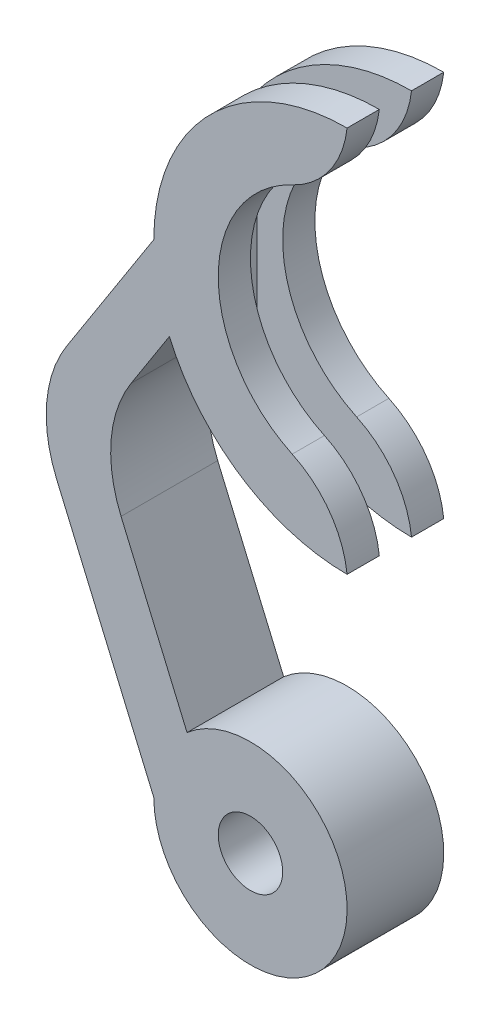
from build123d import *

# Parameters (mm, degrees)
BOSS_EXTRUDE1_DEPTH = 15
FILLET1_R           = 20
FILLET2_R           = 15
SKETCH2_W           = 5
SKETCH2_H           = 60
CUT_EXTRUDE1_DEPTH  = 24


with BuildPart() as part:
    # Sketch1 → Boss-Extrude1 (new body)
    # profile 1 of 6: a face of its own
    with BuildSketch(Plane.XY):
        with BuildLine():
            Line((-20, -30), (-30, -30))
            ThreePointArc((-30, -30), (-29.388396861, -36.026784376), (-27.578524672, -41.807835403))
            Line((-27.578524672, -41.807835403), (-20, -30))
        make_face()
    # profile 2 of 6: a face of its own
    with BuildSketch(Plane.XY):
        with BuildLine():
            Line((0, -10), (0, 0))
            ThreePointArc((0, 0), (-21.213203436, -8.786796564), (-30, -30))
            Line((-30, -30), (-20, -30))
            ThreePointArc((-20, -30), (-14.142135624, -15.857864376), (0, -10))
        make_face()
    # profile 3 of 6: a face of its own
    with BuildSketch(Plane.XY):
        with BuildLine():
            ThreePointArc((0, -50), (-14.142135624, -44.142135624), (-20, -30))
            Line((-20, -30), (-27.578524672, -41.807835403))
            ThreePointArc((-27.578524672, -41.807835403), (-16.519154608, -55.04231481), (0, -60))
            Line((0, -60), (0, -50))
        make_face()
    # profile 4 of 6: a face of its own
    with BuildSketch(Plane.XY):
        with BuildLine():
            ThreePointArc((-27.578524672, -41.807835403), (-29.388396861, -36.026784376), (-30, -30))
            Line((-30, -30), (-49.254650189, -60))
            Line((-49.254650189, -60), (-30, -105))
            ThreePointArc((-30, -105), (-28.650020621, -98.780921528), (-24.84307506, -93.681260081))
            Line((-24.84307506, -93.681260081), (-39.254650189, -60))
            Line((-39.254650189, -60), (-27.578524672, -41.807835403))
        make_face()
    # profile 5 of 6: a face of its own
    with BuildSketch(Plane.XY):
        with BuildLine():
            ThreePointArc((-24.84307506, -93.681260081), (-28.650020621, -98.780921528), (-30, -105))
            Line((-30, -105), (-20, -105))
            Line((-20, -105), (-24.84307506, -93.681260081))
        make_face()
    # profile 6 of 6: a face of its own
    with BuildSketch(Plane.XY):
        with BuildLine():
            Line((-20, -105), (-30, -105))
            ThreePointArc((-30, -105), (-15, -120), (0, -105))
            ThreePointArc((0, -105), (-8.780921528, -91.349979379), (-24.84307506, -93.681260081))
            Line((-24.84307506, -93.681260081), (-20, -105))
        make_face()
        with BuildLine():
            ThreePointArc((-10, -105), (-15, -110), (-20, -105))
            ThreePointArc((-20, -105), (-15, -100), (-10, -105))
        make_face(mode=Mode.SUBTRACT)
    extrude(amount=BOSS_EXTRUDE1_DEPTH)

    # Fillet1
    fillet1_edges = [part.edges().sort_by_distance(p)[0] for p in [
        (-39.254650189, -60, 7.5),
        (-49.254650189, -60, 7.5),
    ]]
    fillet(fillet1_edges, radius=FILLET1_R)

    # Fillet2
    # the kernel refuses this fillet: 15 mm, written as the material it takes off along each edge
    with BuildSketch(Plane(origin=(0, -50, -25), x_dir=(-0.9759000729485309, 0.21821789023600283, 0), z_dir=(0, 0, 1))) as fillet2_piece_1:
        with BuildLine():
            CenterArc((12.001983963, 14.638501094), FILLET2_R, 198.983752857, 58.411864495)
            Line((-2.182178902, 9.759000729), (-2.46586216, 9.661410722))
            ThreePointArc((-2.46586216, 9.661410722), (-1.383859473, 4.814034998), (-0.292770022, -0.065465367))
            Line((-0.292770022, -0.065465367), (0.065465367, -0.292770022))
            ThreePointArc((0.065465367, -0.292770022), (4.364357805, 0.181998541), (8.663250242, -0.292770022))
            Line((8.663250242, -0.292770022), (8.728715609, 0))
        make_face()
    extrude(amount=65, mode=Mode.SUBTRACT)
    with BuildSketch(Plane(origin=(0, -10, -25), x_dir=(0, 1, 0), z_dir=(0, 0, 1))) as fillet2_piece_2:
        with BuildLine():
            CenterArc((11.666666667, 14.90711985), FILLET2_R, 205.208765297, 58.411864495)
            Line((-1.904761905, 8.5183542), (-2.176190476, 8.390578887))
            ThreePointArc((-2.176190476, 8.390578887), (-0.774768563, 4.298892438), (-0.3, 0))
            Line((-0.3, 0), (0, -0.3))
            ThreePointArc((0, -0.3), (5, -0.3), (9.966666667, -0.298142397))
            Line((9.966666667, -0.298142397), (10, 0))
        make_face()
    extrude(amount=65, mode=Mode.SUBTRACT)

    # Sketch2 → Cut-Extrude1 (cut)
    with BuildSketch(Plane(origin=(0, 0, 0), x_dir=(0, 0, -1), z_dir=(1, 0, 0))):
        with Locations((-7.5, -30)):
            Rectangle(SKETCH2_W, SKETCH2_H)
    extrude(amount=-CUT_EXTRUDE1_DEPTH, mode=Mode.SUBTRACT)


solid = part.part
